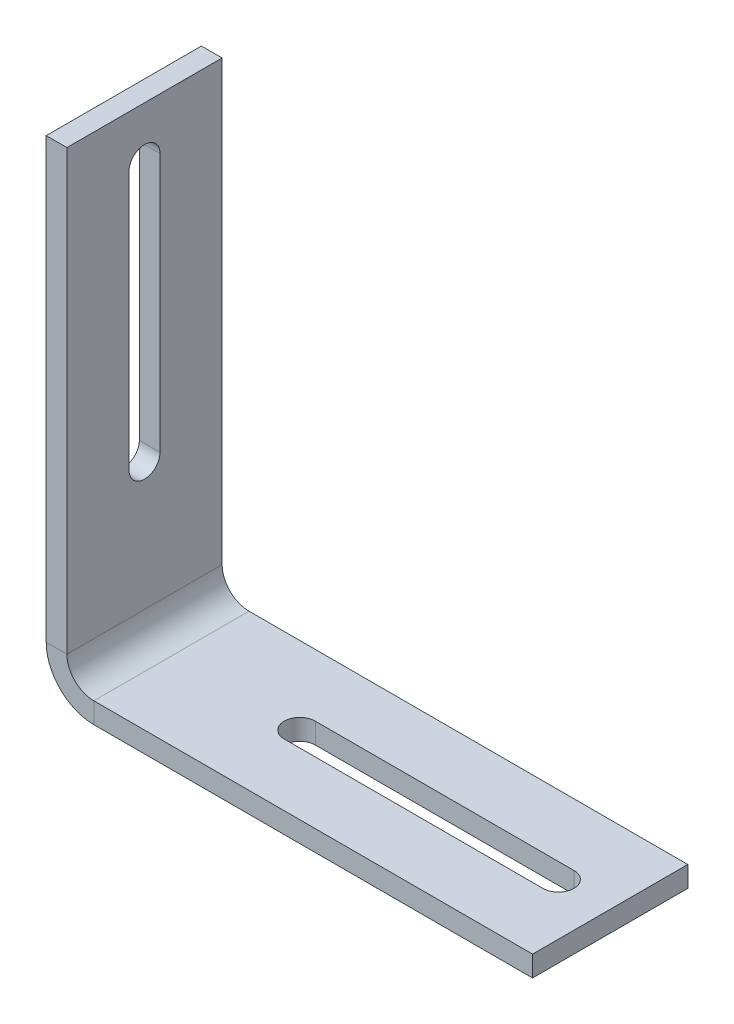
from build123d import *

# Parameters (mm, degrees)
BASE_FLANGE1_DEPTH      = 10
BASE_FLANGE1_DEPTH_BACK = 5
CUT_EXTRUDE1_DEPTH      = 10
CUT_EXTRUDE2_DEPTH      = 10


# Sheet-metal steps are written as plain solids
with BuildPart() as part:
    # Sketch1 → Base-Flange1 (new, two sides: drawn at the far end of the back side and taken through both)
    with BuildSketch(Plane.XY.offset(-BASE_FLANGE1_DEPTH_BACK)):
        with BuildLine():
            Line((0, 0), (0, -42.4))
            ThreePointArc((0, -42.4), (0.761522369, -44.238477631), (2.6, -45))
            Line((2.6, -45), (45, -45))
            Line((45, -45), (45, -47))
            Line((45, -47), (2.6, -47))
            ThreePointArc((2.6, -47), (-0.652691193, -45.652691193), (-2, -42.4))
            Line((-2, -42.4), (-2, 0))
            Line((-2, 0), (0, 0))
        make_face()
    extrude(amount=BASE_FLANGE1_DEPTH + BASE_FLANGE1_DEPTH_BACK)

    # Sketch6 → Cut-Extrude1 (cut)
    with BuildSketch(Plane(origin=(0, 0, 0), x_dir=(0, 0, -1), z_dir=(1, 0, 0))):
        with BuildLine():
            Line((-1, -5), (-1, -30))
            ThreePointArc((-1, -30), (-2.5, -31.5), (-4, -30))
            Line((-4, -30), (-4, -5))
            ThreePointArc((-4, -5), (-2.5, -3.5), (-1, -5))
        make_face()
    extrude(amount=-CUT_EXTRUDE1_DEPTH, mode=Mode.SUBTRACT)

    # Sketch7 → Cut-Extrude2 (cut)
    with BuildSketch(Plane(origin=(0, -45, 0), x_dir=(1, 0, 0), z_dir=(0, 1, 0))):
        with BuildLine():
            Line((40, -4), (15, -4))
            ThreePointArc((15, -4), (13.5, -2.5), (15, -1))
            Line((15, -1), (40, -1))
            ThreePointArc((40, -1), (41.5, -2.5), (40, -4))
        make_face()
    extrude(amount=-CUT_EXTRUDE2_DEPTH, mode=Mode.SUBTRACT)


solid = part.part
